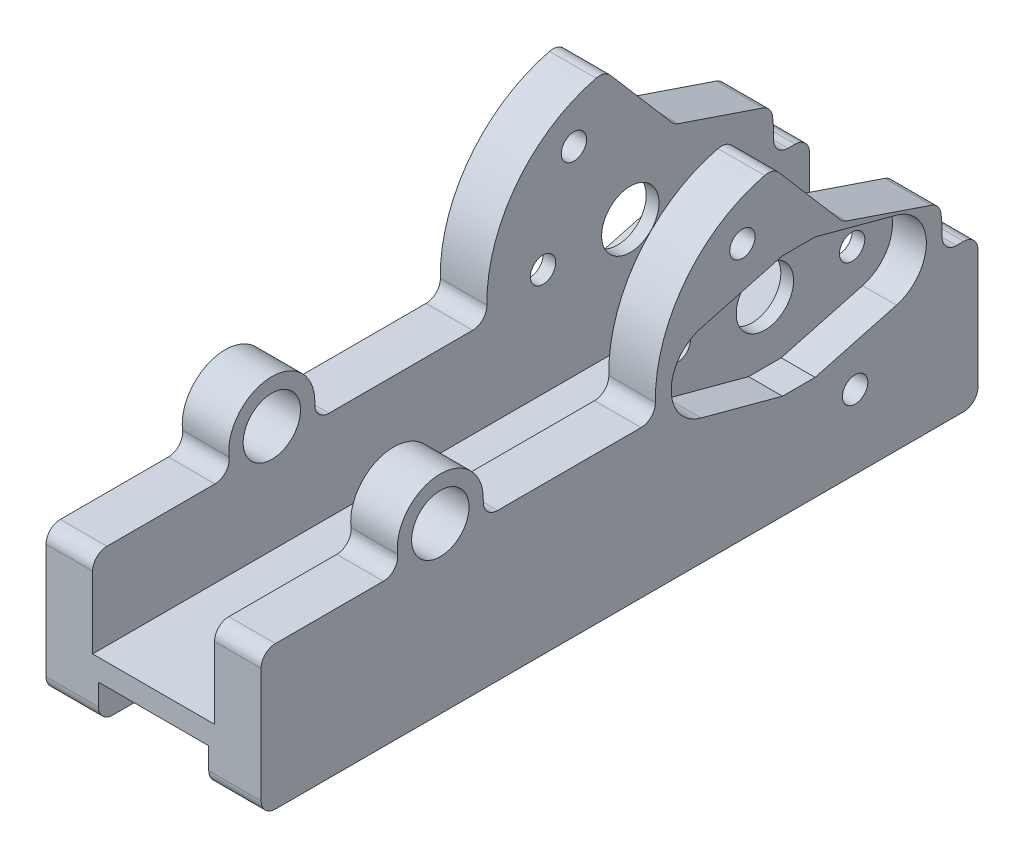
from build123d import *

# Parameters (mm, degrees)
SKETCH1_W               = 38.1
SKETCH1_H               = 127
BOSS_EXTRUDE1_DEPTH     = 57.15
SKETCH2_W               = 21.59
SKETCH2_H               = 254
CUT_EXTRUDE1_DEPTH      = 46.99
CUT_EXTRUDE2_DEPTH      = 94.541341128
CUT_EXTRUDE2_DEPTH_BACK = 94.541341128
SKETCH3_R               = 5.08
CUT_EXTRUDE8_DEPTH      = 94.541341128
SKETCH12_W              = 19.558
SKETCH12_H              = 12.7
CUT_EXTRUDE9_DEPTH      = 140.549828341
SKETCH13_R              = 2.413
CUT_EXTRUDE10_DEPTH     = 80.81826227
F_3_CLEARANCE_HOLE1_D   = 4.5
SKETCH16_R              = 2.2479
CUT_EXTRUDE11_DEPTH     = 93.011478034
CUT_EXTRUDE13_DEPTH     = 6
CUT_EXTRUDE14_DEPTH     = 93.011478034
FILLET3_R               = 2.54


with BuildPart() as part:
    # Sketch1 → Boss-Extrude1 (new body)
    with BuildSketch(Plane(origin=(0, 0, 0), x_dir=(1, 0, 0), z_dir=(0, 1, 0))):
        Rectangle(SKETCH1_W, SKETCH1_H)
    extrude(amount=BOSS_EXTRUDE1_DEPTH)

    # Sketch2 → Cut-Extrude1 (cut)
    with BuildSketch(Plane(origin=(0, 57.15, 0), x_dir=(1, 0, 0), z_dir=(0, 1, 0))):
        with Locations((0, -31.75)):
            Rectangle(SKETCH2_W, SKETCH2_H)
    extrude(amount=-CUT_EXTRUDE1_DEPTH, mode=Mode.SUBTRACT)

    # Sketch3 → Cut-Extrude2 (cut, two sides: drawn at the far end of the back side and taken through both)
    with BuildSketch(Plane(origin=(19.05, 0, 0), x_dir=(0, 0, -1), z_dir=(1, 0, 0)).offset(-CUT_EXTRUDE2_DEPTH_BACK)):
        with Locations((-31.75, 29.21)):
            Circle(SKETCH3_R)
        with Locations((31.75, 29.21)):
            Circle(SKETCH3_R)
    extrude(amount=CUT_EXTRUDE2_DEPTH + CUT_EXTRUDE2_DEPTH_BACK, mode=Mode.SUBTRACT)

    # Sketch11 → Cut-Extrude8 (cut, through all)
    with BuildSketch(Plane.ZY.offset(19.05)):
        with BuildLine():
            Line((38.349113577, 25.4), (63.5, 25.4))
            Line((63.5, 25.4), (63.5, 57.15))
            Line((63.5, 57.15), (-63.5, 57.15))
            Line((-63.5, 57.15), (-63.5, 26.142048402))
            Line((-63.5, 26.142048402), (-56.964037289, 26.142048402))
            ThreePointArc((-56.964037289, 26.142048402), (-31.750000057, 54.609999908), (-6.535962824, 26.142048402))
            Line((-6.535962824, 26.142048402), (24.774896202, 26.142048402))
            ThreePointArc((24.774896202, 26.142048402), (32.165934032, 36.818639752), (38.349113577, 25.4))
        make_face()
    extrude(amount=-CUT_EXTRUDE8_DEPTH, mode=Mode.SUBTRACT)

    # Sketch12 → Cut-Extrude9 (cut, through all)
    with BuildSketch(Plane.XY.offset(63.5)):
        Rectangle(SKETCH12_W, SKETCH12_H)
    extrude(amount=-CUT_EXTRUDE9_DEPTH, mode=Mode.SUBTRACT)

    # Sketch13 → Cut-Extrude10 (cut, through all)
    with BuildSketch(Plane(origin=(0, 10.16, 0), x_dir=(1, 0, 0), z_dir=(0, 1, 0))):
        with Locations((0, -44.45)):
            Circle(SKETCH13_R)
        with Locations((0, 57.15)):
            Circle(SKETCH13_R)
        with Locations((0, 6.35)):
            Circle(SKETCH13_R)
    extrude(amount=-CUT_EXTRUDE10_DEPTH, mode=Mode.SUBTRACT)

    # #3 Clearance Hole1 (through all)
    with Locations(Plane.ZY.offset(19.05)):
        with Locations((-21.766489637, 45.37568946), (-41.733510476, 13.044310357)):
            Hole(F_3_CLEARANCE_HOLE1_D / 2)

    # Sketch16 → Cut-Extrude11 (cut, through all)
    with BuildSketch(Plane.ZY.offset(19.05)):
        with Locations((-47.200000057, 29.209999908)):
            Circle(SKETCH16_R)
        with Locations((-16.300000057, 29.209999908)):
            Circle(SKETCH16_R)
    extrude(amount=-CUT_EXTRUDE11_DEPTH, mode=Mode.SUBTRACT)

    # Sketch21 → Cut-Extrude13 (cut)
    with BuildSketch(Plane.ZY.offset(19.05)):
        with BuildLine():
            Line((-49.051132759, 36.116215079), (-34.636731482, 39.979832013))
            Line((-34.636731482, 39.979832013), (-28.863268699, 39.979832039))
            Line((-28.863268699, 39.979832039), (-14.448867387, 36.116215233))
            ThreePointArc((-14.448867387, 36.116215233), (-9.150000043, 29.210000101), (-14.448867326, 22.303784921))
            Line((-14.448867326, 22.303784921), (-28.863268603, 18.440167987))
            Line((-28.863268603, 18.440167987), (-34.636731386, 18.440167961))
            Line((-34.636731386, 18.440167961), (-49.051132698, 22.303784767))
            ThreePointArc((-49.051132698, 22.303784767), (-54.350000043, 29.209999899), (-49.051132759, 36.116215079))
        make_face()
    cut_extrude13 = extrude(amount=-CUT_EXTRUDE13_DEPTH, mode=Mode.SUBTRACT)

    # Sketch22 → Cut-Extrude14 (cut, through all)
    with BuildSketch(Plane.ZY.offset(19.05)):
        Polygon((-56.683234461, 34.057042479), (-39.570689377, 39.862220003), (-27.251193914, 54.208414749), (-28.68815775, 55.797566838), (-55.153027555, 53.24322782), (-63.3901932, 32.021075452), align=None)
    extrude(amount=-CUT_EXTRUDE14_DEPTH, mode=Mode.SUBTRACT)

    # Fillet3
    fillet3_edges = [part.edges().sort_by_distance(p)[0] for p in [
        (-14.9225, 25.4, 63.5),
        (14.9225, 25.4, 63.5),
        (-14.4145, 0, 63.5),
        (14.4145, 0, 63.5),
        (14.4145, 0, -63.5),
        (-14.4145, 0, -63.5),
        (-14.9225, 26.142048402, -63.5),
        (14.9225, 26.142048402, -63.5),
        (-14.9225, 26.142048402, -6.535962824),
        (14.9225, 26.142048402, -6.535962824),
        (14.9225, 54.208414749, -27.251193914),
        (-14.9225, 54.208414749, -27.251193914),
        (-14.9225, 39.862220003, -39.570689377),
        (14.9225, 39.862220003, -39.570689377),
        (14.9225, 34.057042479, -56.683234461),
        (-14.9225, 34.057042479, -56.683234461),
        (-14.9225, 26.142048402, -56.964037289),
        (14.9225, 26.142048402, -56.964037289),
        (14.9225, 26.142048402, 24.774896202),
        (14.9225, 25.4, 38.349113577),
        (-14.9225, 25.4, 38.349113577),
        (-14.9225, 26.142048402, 24.774896202),
    ]]
    fillet(fillet3_edges, radius=FILLET3_R)

    # Mirror1: Cut-Extrude13 across plane
    add(cut_extrude13.mirror(Plane(origin=(0, 0, 0), x_dir=(0, 0, 1), z_dir=(1, 0, 0))), mode=Mode.SUBTRACT)


solid = part.part
